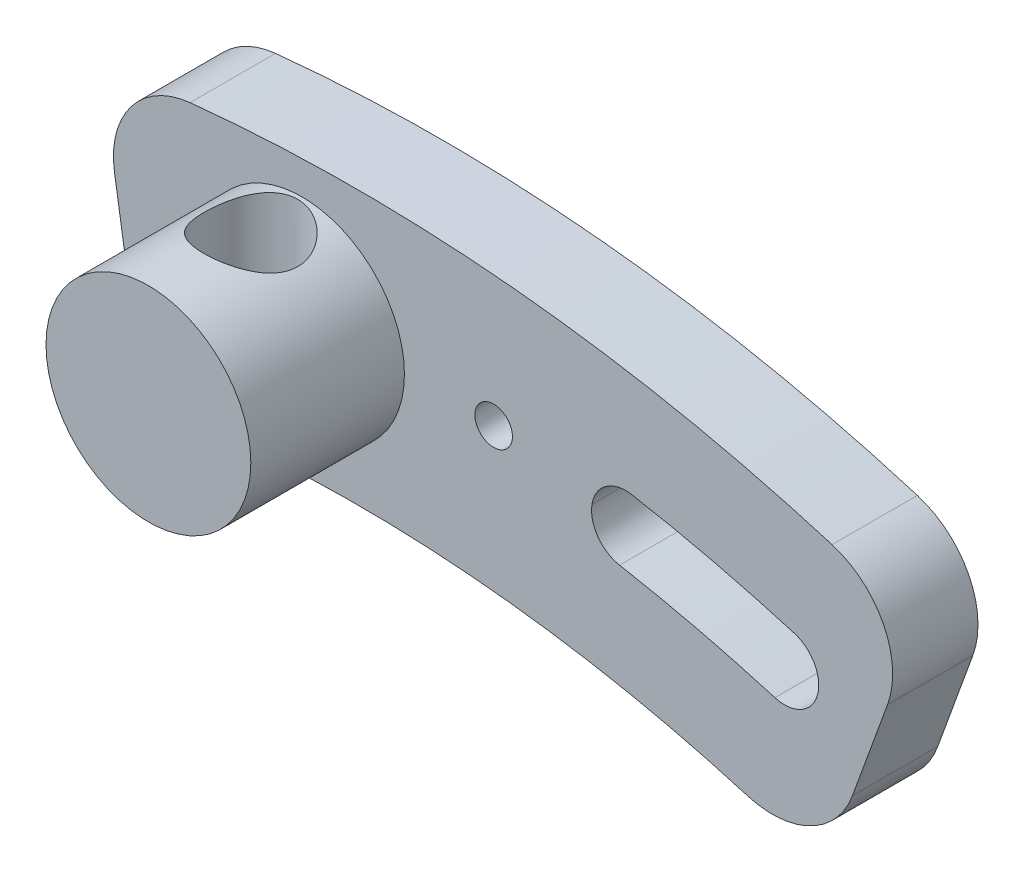
from build123d import *

# Parameters (mm, degrees)
BOSS_EXTRUDE1_DEPTH = 5
SKETCH1_13_R        = 1.1
CUT_EXTRUDE2_DEPTH  = 10
FILLET1_R           = 2
BOSS_EXTRUDE2_DEPTH = 14
SKETCH2_R           = 1.35
CUT_EXTRUDE3_DEPTH  = 110
FILLET2_R           = 5
CUT_EXTRUDE4_START  = 200
SKETCH2_3_R         = 2.75
CUT_EXTRUDE4_DEPTH  = 111


with BuildPart() as part:
    # Sketch1 → Boss-Extrude1 (new body)
    with BuildSketch(Plane.XY):
        with BuildLine():
            Line((27.361611466, 75.175409663), (32.833933759, 90.210491595))
            ThreePointArc((32.833933759, 90.210491595), (9.201192242, 95.558035043), (-15.017708644, 94.818080697))
            Line((-15.017708644, 94.818080697), (-12.514757203, 79.015067248))
            ThreePointArc((-12.514757203, 79.015067248), (7.667660202, 79.631695869), (27.361611466, 75.175409663))
        make_face()
    extrude(amount=BOSS_EXTRUDE1_DEPTH)

    # Sketch1<13> → Cut-Extrude2 (cut)
    with BuildSketch(Plane.XY):
        with BuildLine():
            ThreePointArc((13.453363993, 84.941197291), (19.959187303, 83.651843029), (26.346302102, 81.864964213))
            Line((26.346302102, 81.864964213), (27.571711502, 85.672636967))
            ThreePointArc((27.571711502, 85.672636967), (20.887521597, 87.542626426), (14.079101854, 88.891950654))
            Line((14.079101854, 88.891950654), (13.453363993, 84.941197291))
        make_face()
        with Locations((8, 88)):
            Circle(SKETCH1_13_R)
    extrude(amount=CUT_EXTRUDE2_DEPTH, mode=Mode.SUBTRACT)

    # Fillet1
    fillet1_edges = [part.edges().sort_by_distance(p)[0] for p in [
        (26.346302102, 81.864964213, 2.5),
        (27.571711502, 85.672636967, 2.5),
        (14.079101854, 88.891950654, 2.5),
        (13.453363993, 84.941197291, 2.5),
    ]]
    fillet(fillet1_edges, radius=FILLET1_R - 0.0001)  # a hair under: the kernel refuses the full size

    # Sketch1<14> → Boss-Extrude2 (add)
    with BuildSketch(Plane.XY):
        with BuildLine():
            ThreePointArc((-0.5, 93.344488005), (-9.226985142, 88), (-0.5, 82.655511995))
            Line((-0.5, 82.655511995), (-0.5, 93.344488005))
        make_face()
        with BuildLine():
            Line((-0.5, 93.344488005), (-0.5, 82.655511995))
            ThreePointArc((-0.5, 82.655511995), (1.889747744, 84.866464525), (2.773014858, 88))
            ThreePointArc((2.773014858, 88), (1.889747744, 91.133535475), (-0.5, 93.344488005))
        make_face()
    extrude(amount=BOSS_EXTRUDE2_DEPTH)

    # Sketch2 → Cut-Extrude3 (cut)
    with BuildSketch(Plane(origin=(0, 0, 0), x_dir=(1, 0, 0), z_dir=(0, 1, 0))):
        with Locations(Location((-3.226985142, -8, 0), (0, 0, 90))):
            Circle(SKETCH2_R)
    extrude(amount=CUT_EXTRUDE3_DEPTH, mode=Mode.SUBTRACT)

    # Fillet2
    fillet2_edges = [part.edges().sort_by_distance(p)[0] for p in [
        (27.361611466, 75.175409663, 2.5),
        (-12.514757203, 79.015067248, 2.5),
        (-15.017708644, 94.818080697, 2.5),
        (32.833933759, 90.210491595, 2.5),
    ]]
    fillet(fillet2_edges, radius=FILLET2_R)

    # Sketch2<3> → Cut-Extrude4 (cut)
    with BuildSketch(Plane(origin=(0, 0, 0), x_dir=(1, 0, 0), z_dir=(0, 1, 0)).offset(CUT_EXTRUDE4_START)):
        with Locations(Location((-3.226985142, -8, 0), (0, 0, 270))):
            Circle(SKETCH2_3_R)
    extrude(amount=-CUT_EXTRUDE4_DEPTH, mode=Mode.SUBTRACT)


solid = part.part
